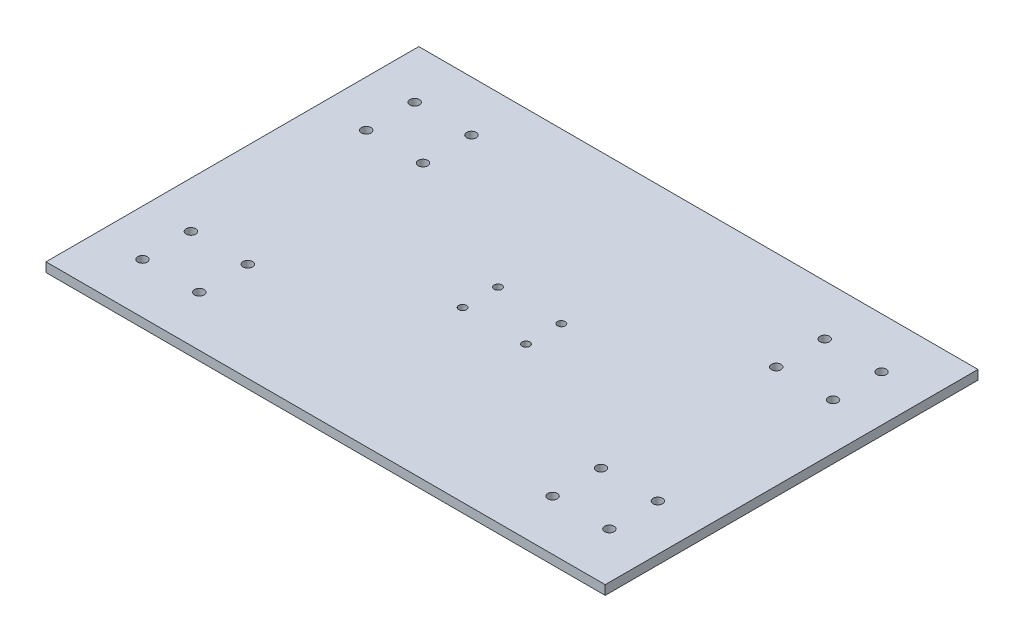
from build123d import *

# Parameters (mm, degrees)
SKETCH1_W           = 300
SKETCH1_H           = 200
BOSS_EXTRUDE1_DEPTH = 2.5
SKETCH2_R           = 2.55
CUT_EXTRUDE1_DEPTH  = 181.346887969
SKETCH3_R           = 2.05
CUT_EXTRUDE2_DEPTH  = 181.346887969


with BuildPart() as part:
    # Sketch1 → Boss-Extrude1 (new, symmetric)
    with BuildSketch(Plane(origin=(0, 0, 0), x_dir=(1, 0, 0), z_dir=(0, 1, 0))):
        Rectangle(SKETCH1_W, SKETCH1_H)
    extrude(amount=BOSS_EXTRUDE1_DEPTH, both=True)

    # Sketch2 → Cut-Extrude1 (cut, through all)
    with BuildSketch(Plane(origin=(0, 2.5, 0), x_dir=(1, 0, 0), z_dir=(0, 1, 0))):
        with Locations((-125.25, 73)):
            Circle(SKETCH2_R)
        with Locations((-125.25, 47)):
            Circle(SKETCH2_R)
        with Locations((-94.75, 73)):
            Circle(SKETCH2_R)
        with Locations((-94.75, 47)):
            Circle(SKETCH2_R)
        with Locations((-125.25, -47)):
            Circle(SKETCH2_R)
        with Locations((-125.25, -73)):
            Circle(SKETCH2_R)
        with Locations((-94.75, -73)):
            Circle(SKETCH2_R)
        with Locations((-94.75, -47)):
            Circle(SKETCH2_R)
        with Locations((125.25, -47)):
            Circle(SKETCH2_R)
        with Locations((94.75, -47)):
            Circle(SKETCH2_R)
        with Locations((94.75, -73)):
            Circle(SKETCH2_R)
        with Locations((125.25, -73)):
            Circle(SKETCH2_R)
        with Locations((94.75, 73)):
            Circle(SKETCH2_R)
        with Locations((94.75, 47)):
            Circle(SKETCH2_R)
        with Locations((125.25, 73)):
            Circle(SKETCH2_R)
        with Locations((125.25, 47)):
            Circle(SKETCH2_R)
    extrude(amount=-CUT_EXTRUDE1_DEPTH, mode=Mode.SUBTRACT)

    # Sketch3 → Cut-Extrude2 (cut, through all)
    with BuildSketch(Plane(origin=(0, 2.5, 0), x_dir=(1, 0, 0), z_dir=(0, 1, 0))):
        with Locations((-17, 9.5)):
            Circle(SKETCH3_R)
        with Locations((17, 9.5)):
            Circle(SKETCH3_R)
        with Locations((17, -9.5)):
            Circle(SKETCH3_R)
        with Locations((-17, -9.5)):
            Circle(SKETCH3_R)
    extrude(amount=-CUT_EXTRUDE2_DEPTH, mode=Mode.SUBTRACT)


solid = part.part
